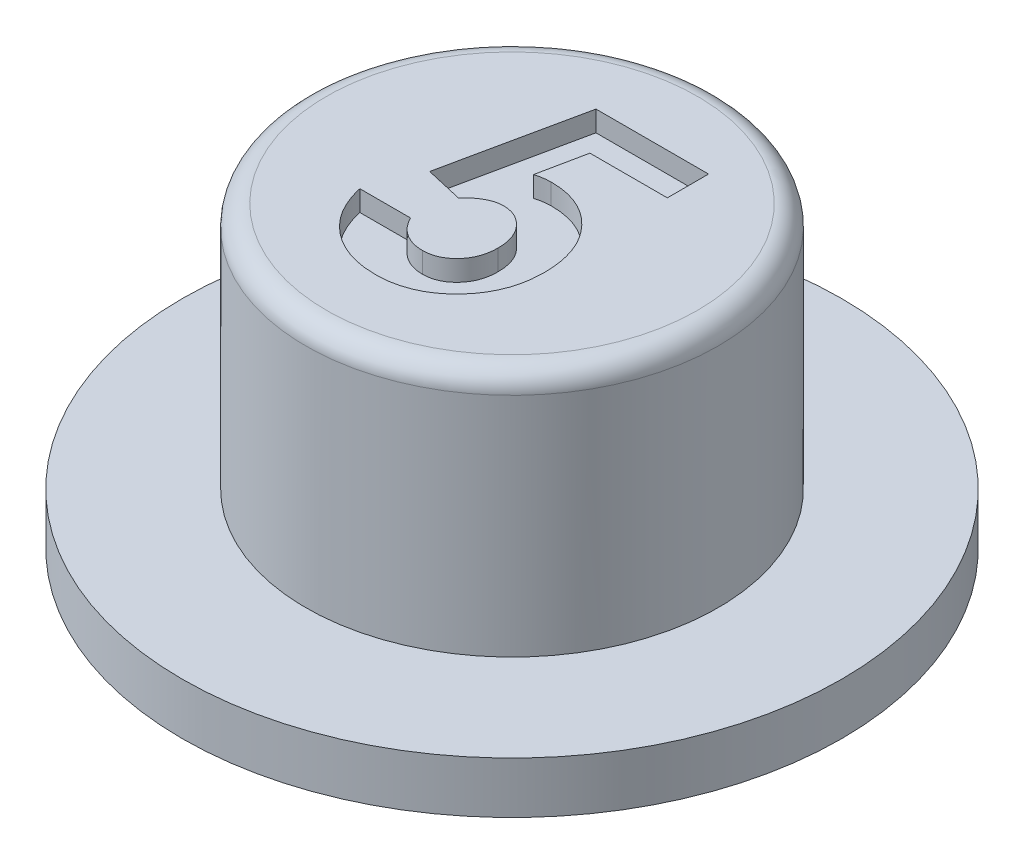
from build123d import *

# Parameters (mm, degrees)
SKETCH2_W          = 2.5
SKETCH2_H          = 3.5
CUT_EXTRUDE1_DEPTH = 3.5
FILLET1_R          = 0.5
CUT_EXTRUDE2_DEPTH = 0.5


with BuildPart() as part:
    # Sketch1 → Revolve1 (revolve)
    with BuildSketch(Plane.XY):
        Polygon((0, 7.25), (5, 7.25), (5, 1.25), (8, 1.25), (8, 0), (0, 0), align=None)
    revolve(axis=Axis((0, 7.25, 0), (0, -1, 0)))

    # Sketch2 → Cut-Extrude1 (cut)
    with BuildSketch(Plane.XZ):
        Rectangle(SKETCH2_W, SKETCH2_H)
    extrude(amount=-CUT_EXTRUDE1_DEPTH, mode=Mode.SUBTRACT)

    # Fillet1
    fillet1_edges = [part.edges().sort_by_distance(p)[0] for p in [
        (-5, 7.25, 0),
    ]]
    fillet(fillet1_edges, radius=FILLET1_R)

    # Sketch3 → Cut-Extrude2 (cut)
    with BuildSketch(Plane(origin=(0, 7.25, 0), x_dir=(1, 0, 0), z_dir=(0, 1, 0))):
        with BuildLine():
            Line((-0.962740385, 3), (1.769230769, 3))
            Line((1.769230769, 3), (1.769230769, 2))
            Line((1.769230769, 2), (-0.109375, 2))
            Line((-0.109375, 2), (-0.34375, 0.865384615))
            add(Edge.make_bspline(
                [(-0.34375, 0.865384615), (-0.311813051, 0.874279459), (-0.248826826, 0.891821918), (-0.153938001, 0.909414784), (-0.061977505, 0.920817921), (-0.001633589, 0.922338947), (0.027644231, 0.923076923)],
                knots=[0, 0, 0, 0, 1.05461699, 2.079921384, 3.068411212, 4, 4, 4, 4], degree=3))
            add(Edge.make_bspline(
                [(0.027644231, 0.923076923), (0.091443667, 0.921614996), (0.21720641, 0.918733216), (0.401181345, 0.89137572), (0.577348214, 0.848288493), (0.745167925, 0.786837219), (0.904476543, 0.706856797), (1.05546718, 0.610102908), (1.198325152, 0.496405615), (1.330512701, 0.365693734), (1.451972142, 0.22216913), (1.557574199, 0.066932084), (1.647764945, -0.097803875), (1.719499547, -0.273062741), (1.77611861, -0.457743771), (1.817032809, -0.651965315), (1.841227419, -0.855957554), (1.844489914, -0.995126873), (1.846153846, -1.066105769)],
                knots=[0, 0, 0, 0, 1.01440847, 1.999622559, 2.951875003, 3.895578053, 4.836219714, 5.782137149, 6.743708247, 7.735272588, 8.734977101, 9.730283169, 10.717124674, 11.717316708, 12.737475749, 13.78628267, 14.87096371, 16, 16, 16, 16], degree=3))
            add(Edge.make_bspline(
                [(1.846153846, -1.066105769), (1.844120495, -1.13789044), (1.840108097, -1.279542579), (1.813930883, -1.48782133), (1.767727629, -1.687305353), (1.704262837, -1.878528664), (1.620652036, -2.060085816), (1.520098604, -2.233857605), (1.400902455, -2.39855418), (1.264233311, -2.552487201), (1.115656024, -2.693184937), (0.957456286, -2.816957005), (0.790745498, -2.921110197), (0.615519637, -3.005283585), (0.43278403, -3.071880071), (0.242483215, -3.120359134), (0.043692354, -3.148159183), (-0.091260811, -3.151929666), (-0.159855769, -3.153846154)],
                knots=[0, 0, 0, 0, 1.06808661, 2.107647099, 3.116961351, 4.110378221, 5.100014249, 6.085620622, 7.093190682, 8.119403071, 9.144090782, 10.133780668, 11.103064255, 12.062861538, 13.020824475, 13.992378307, 14.979551724, 16, 16, 16, 16], degree=3))
            add(Edge.make_bspline(
                [(-0.159855769, -3.153846154), (-0.221198198, -3.152278347), (-0.342178305, -3.149186305), (-0.520376692, -3.130180984), (-0.692179725, -3.096579398), (-0.856675318, -3.047949202), (-1.01559424, -2.988096533), (-1.167099343, -2.913239459), (-1.312023174, -2.824803359), (-1.449954202, -2.724402196), (-1.578651246, -2.61130418), (-1.696112271, -2.487498915), (-1.8030484, -2.354546905), (-1.897171369, -2.210807929), (-1.97818613, -2.056494351), (-2.050031672, -1.893424792), (-2.108837968, -1.719896287), (-2.13868047, -1.599596687), (-2.153846154, -1.538461538)],
                knots=[0, 0, 0, 0, 1.054957082, 2.080596141, 3.077793124, 4.061112343, 5.027190972, 5.994718051, 6.962465889, 7.943658696, 8.924948258, 9.904494768, 10.875059, 11.855380583, 12.854004648, 13.869083016, 14.917087635, 16, 16, 16, 16], degree=3))
            Line((-2.153846154, -1.538461538), (-0.923076923, -1.538461538))
            add(Edge.make_bspline(
                [(-0.923076923, -1.538461538), (-0.900578432, -1.580825707), (-0.856855182, -1.663155633), (-0.773683893, -1.77246098), (-0.680578917, -1.865671884), (-0.578380109, -1.943699036), (-0.466425285, -2.002155651), (-0.349276393, -2.046486443), (-0.225461741, -2.072103566), (-0.141138496, -2.07530596), (-0.098557692, -2.076923077)],
                knots=[0, 0, 0, 0, 1.104910296, 2.147267069, 3.153527244, 4.136738762, 5.099945312, 6.05603338, 7.018353, 8, 8, 8, 8], degree=3))
            add(Edge.make_bspline(
                [(-0.098557692, -2.076923077), (-0.068879444, -2.075806444), (-0.010486989, -2.073609449), (0.075545059, -2.061986797), (0.157666428, -2.039973757), (0.236487672, -2.009490813), (0.312220524, -1.97147514), (0.383779327, -1.923482829), (0.452409076, -1.8682419), (0.517064948, -1.804852747), (0.575624531, -1.734188586), (0.626974881, -1.658255127), (0.672889174, -1.57873963), (0.706898594, -1.492492284), (0.734749432, -1.402088467), (0.755259916, -1.306846235), (0.767517243, -1.206654352), (0.768651944, -1.138256163), (0.769230769, -1.103365385)],
                knots=[0, 0, 0, 0, 0.978869489, 1.925942215, 2.855067702, 3.774946051, 4.70828698, 5.642468714, 6.60995405, 7.609372294, 8.622401667, 9.629904756, 10.629323, 11.642352373, 12.678539694, 13.745912462, 14.850161547, 16, 16, 16, 16], degree=3))
            add(Edge.make_bspline(
                [(0.769230769, -1.103365385), (0.768558976, -1.0692845), (0.767251313, -1.002945232), (0.75643407, -0.905535424), (0.737082229, -0.813111144), (0.710715181, -0.724964493), (0.67696221, -0.641630739), (0.635713824, -0.562613839), (0.586793806, -0.488313196), (0.529939513, -0.420241497), (0.46931068, -0.357804198), (0.404175831, -0.303197035), (0.335121798, -0.25787688), (0.264294348, -0.218311067), (0.188866306, -0.189515931), (0.110533744, -0.169685782), (0.02937904, -0.155135217), (-0.025974822, -0.154280318), (-0.054086538, -0.153846154)],
                knots=[0, 0, 0, 0, 1.166249705, 2.270133367, 3.348514167, 4.393962215, 5.415026464, 6.420877785, 7.440098956, 8.453121383, 9.451844239, 10.415694839, 11.355045125, 12.27538808, 13.187007209, 14.108269027, 15.039275622, 16, 16, 16, 16], degree=3))
            add(Edge.make_bspline(
                [(-0.054086538, -0.153846154), (-0.084622396, -0.15500482), (-0.145822806, -0.157327036), (-0.236751298, -0.176222283), (-0.326583444, -0.206801882), (-0.415818805, -0.248991285), (-0.503571565, -0.304203902), (-0.592157562, -0.368961971), (-0.678611632, -0.44797078), (-0.733581535, -0.506816721), (-0.762019231, -0.537259615)],
                knots=[0, 0, 0, 0, 0.88288272, 1.769486374, 2.674910571, 3.623812639, 4.617874466, 5.670434592, 6.794841017, 8, 8, 8, 8], degree=3))
            Line((-0.762019231, -0.537259615), (-1.668269231, -0.329326923))
            Line((-1.668269231, -0.329326923), (-0.962740385, 3))
        make_face()
    extrude(amount=-CUT_EXTRUDE2_DEPTH, mode=Mode.SUBTRACT)


solid = part.part
